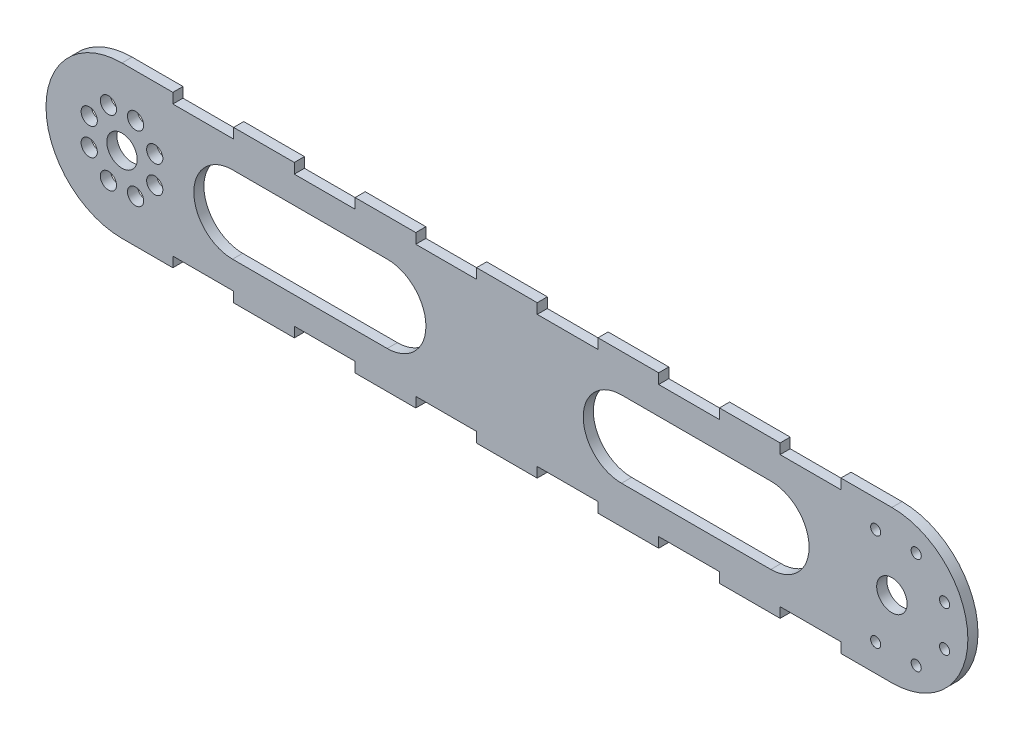
from build123d import *

# Parameters (mm, degrees)
SKETCH3_R           = 4
SKETCH3_R_2         = 2.5
SKETCH3_R_3         = 7.5
BOSS_EXTRUDE1_DEPTH = 5


with BuildPart() as part:
    # Sketch3 → Boss-Extrude1 (new body)
    with BuildSketch(Plane.XY):
        with BuildLine():
            Line((4.149250972, 37.5), (-20.962749028, 37.5))
            ThreePointArc((-20.962749028, 37.5), (-58.462749028, 0), (-20.962749028, -37.5))
            Line((-20.962749028, -37.5), (4.149250972, -37.5))
            Line((4.149250972, -37.5), (4.149250972, -32.5))
            Line((4.149250972, -32.5), (34.149250972, -32.5))
            Line((34.149250972, -32.5), (34.149250972, -37.5))
            Line((34.149250972, -37.5), (64.093250972, -37.5))
            Line((64.093250972, -37.5), (64.093250972, -32.5))
            Line((64.093250972, -32.5), (94.093250972, -32.5))
            Line((94.093250972, -32.5), (94.093250972, -37.5))
            Line((94.093250972, -37.5), (124.037250972, -37.5))
            Line((124.037250972, -37.5), (124.037250972, -32.5))
            Line((124.037250972, -32.5), (154.037250972, -32.5))
            Line((154.037250972, -32.5), (154.037250972, -37.5))
            Line((154.037250972, -37.5), (183.981250972, -37.5))
            Line((183.981250972, -37.5), (183.981250972, -32.5))
            Line((183.981250972, -32.5), (213.981250972, -32.5))
            Line((213.981250972, -32.5), (213.981250972, -37.5))
            Line((213.981250972, -37.5), (243.925250972, -37.5))
            Line((243.925250972, -37.5), (243.925250972, -32.5))
            Line((243.925250972, -32.5), (273.925250972, -32.5))
            Line((273.925250972, -32.5), (273.925250972, -37.5))
            Line((273.925250972, -37.5), (303.869250972, -37.5))
            Line((303.869250972, -37.5), (303.869250972, -32.5))
            Line((303.869250972, -32.5), (333.869250972, -32.5))
            Line((333.869250972, -32.5), (333.869250972, -37.5))
            Line((333.869250972, -37.5), (359.037250972, -37.5))
            ThreePointArc((359.037250972, -37.5), (396.537250972, 0), (359.037250972, 37.5))
            Line((359.037250972, 37.5), (333.869250972, 37.5))
            Line((333.869250972, 37.5), (333.869250972, 32.5))
            Line((333.869250972, 32.5), (303.869250972, 32.5))
            Line((303.869250972, 32.5), (303.869250972, 37.5))
            Line((303.869250972, 37.5), (273.925250972, 37.5))
            Line((273.925250972, 37.5), (273.925250972, 32.5))
            Line((273.925250972, 32.5), (243.925250972, 32.5))
            Line((243.925250972, 32.5), (243.925250972, 37.5))
            Line((243.925250972, 37.5), (213.981250972, 37.5))
            Line((213.981250972, 37.5), (213.981250972, 32.5))
            Line((213.981250972, 32.5), (183.981250972, 32.5))
            Line((183.981250972, 32.5), (183.981250972, 37.5))
            Line((183.981250972, 37.5), (154.037250972, 37.5))
            Line((154.037250972, 37.5), (154.037250972, 32.5))
            Line((154.037250972, 32.5), (124.037250972, 32.5))
            Line((124.037250972, 32.5), (124.037250972, 37.5))
            Line((124.037250972, 37.5), (94.093250972, 37.5))
            Line((94.093250972, 37.5), (94.093250972, 32.5))
            Line((94.093250972, 32.5), (64.093250972, 32.5))
            Line((64.093250972, 32.5), (64.093250972, 37.5))
            Line((64.093250972, 37.5), (34.149250972, 37.5))
            Line((34.149250972, 37.5), (34.149250972, 32.5))
            Line((34.149250972, 32.5), (4.149250972, 32.5))
            Line((4.149250972, 32.5), (4.149250972, 37.5))
        make_face()
        with Locations((-27.659709094, -16.167891819)):
            Circle(SKETCH3_R, mode=Mode.SUBTRACT)
        with Locations((-14.265788962, -16.167891819)):
            Circle(SKETCH3_R, mode=Mode.SUBTRACT)
        with Locations((-37.130640847, -6.696960066)):
            Circle(SKETCH3_R, mode=Mode.SUBTRACT)
        with Locations((-4.794857209, -6.696960066)):
            Circle(SKETCH3_R, mode=Mode.SUBTRACT)
        with Locations((351.037250972, -24)):
            Circle(SKETCH3_R_2, mode=Mode.SUBTRACT)
        with Locations((371.037250972, -24)):
            Circle(SKETCH3_R_2, mode=Mode.SUBTRACT)
        with Locations((385.037250972, -10)):
            Circle(SKETCH3_R_2, mode=Mode.SUBTRACT)
        with BuildLine():
            ThreePointArc((-13.462749028, 0), (-28.318638631, -1.463177415), (-14.033652534, 2.870125743))
            ThreePointArc((-14.033652534, 2.870125743), (-13.606859425, 1.463177415), (-13.462749028, 0))
        make_face(mode=Mode.SUBTRACT)
        with Locations((-37.130640847, 6.696960066)):
            Circle(SKETCH3_R, mode=Mode.SUBTRACT)
        with BuildLine():
            ThreePointArc((-0.794857209, 6.696960066), (-4.014495921, 2.773818945), (-8.490375339, 5.166226337))
            ThreePointArc((-8.490375339, 5.166226337), (-5.575218497, 10.620101188), (-0.794857209, 6.696960066))
        make_face(mode=Mode.SUBTRACT)
        with Locations((-27.659709094, 16.167891819)):
            Circle(SKETCH3_R, mode=Mode.SUBTRACT)
        with Locations((-14.265788962, 16.167891819)):
            Circle(SKETCH3_R, mode=Mode.SUBTRACT)
        with BuildLine():
            ThreePointArc((33.600604321, -19.094555463), (14.506048858, 0), (33.600604321, 19.094555463))
            Line((33.600604321, 19.094555463), (109.950723564, 19.094555463))
            ThreePointArc((109.950723564, 19.094555463), (129.045279027, 0), (109.950723564, -19.094555463))
            Line((109.950723564, -19.094555463), (33.600604321, -19.094555463))
        make_face(mode=Mode.SUBTRACT)
        with BuildLine():
            ThreePointArc((225.572886902, -18.875158569), (206.697728333, 0), (225.572886902, 18.875158569))
            Line((225.572886902, 18.875158569), (299.290243413, 18.875158569))
            ThreePointArc((299.290243413, 18.875158569), (318.165401982, 0), (299.290243413, -18.875158569))
            Line((299.290243413, -18.875158569), (225.572886902, -18.875158569))
        make_face(mode=Mode.SUBTRACT)
        with Locations((359.037250972, 0)):
            Circle(SKETCH3_R_3, mode=Mode.SUBTRACT)
        with Locations((385.037250972, 10)):
            Circle(SKETCH3_R_2, mode=Mode.SUBTRACT)
        with Locations((351.037250972, 24)):
            Circle(SKETCH3_R_2, mode=Mode.SUBTRACT)
        with Locations((371.037250972, 24)):
            Circle(SKETCH3_R_2, mode=Mode.SUBTRACT)
    extrude(amount=BOSS_EXTRUDE1_DEPTH)


solid = part.part
